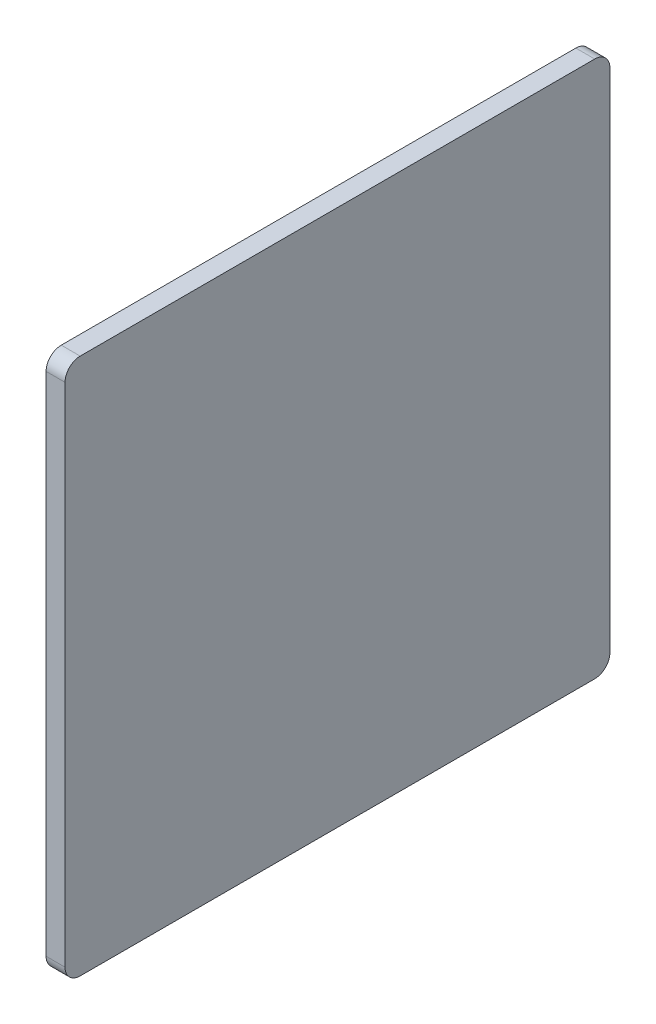
from build123d import *

# Parameters (mm, degrees)
SKETCH1_W           = 91.349999926
SKETCH1_H           = 90
BOSS_EXTRUDE1_DEPTH = 3.175
FILLET1_R           = 2.54


with BuildPart() as part:
    # Sketch1 → Boss-Extrude1 (new body)
    with BuildSketch(Plane(origin=(0, 0, 0), x_dir=(0, 0, -1), z_dir=(1, 0, 0))):
        Rectangle(SKETCH1_W, SKETCH1_H)
    extrude(amount=BOSS_EXTRUDE1_DEPTH)

    # Fillet1
    fillet1_edges = [part.edges().sort_by_distance(p)[0] for p in [
        (1.5875, -45, 45.674999963),
        (1.5875, -45, -45.674999963),
        (1.5875, 45, -45.674999963),
        (1.5875, 45, 45.674999963),
    ]]
    fillet(fillet1_edges, radius=FILLET1_R)


solid = part.part
